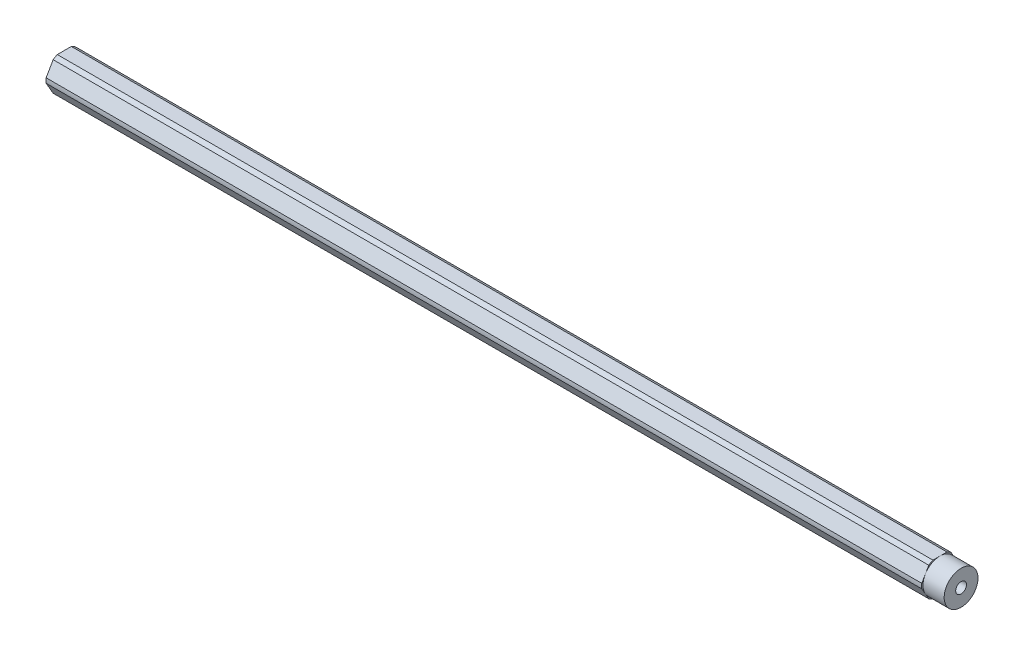
from build123d import *

# Parameters (mm, degrees)
SKETCH1_R                            = 2.0193
BOSS_EXTRUDE1_DEPTH                  = 168.275
F_10_32_TAPPED_HOLE1_D               = 4.0386
F_10_32_TAPPED_HOLE1_DEPTH           = 16.34744
F_10_32_TAPPED_HOLE1_TIP             = 1.213317848
F_10_32_TAPPED_HOLE1_ON_FACE_2_D     = 4.0386
F_10_32_TAPPED_HOLE1_ON_FACE_2_DEPTH = 16.34744
F_10_32_TAPPED_HOLE1_ON_FACE_2_TIP   = 1.213317848
SKETCH3_R                            = 8.89
SKETCH3_R_2                          = 6.35
CUT_EXTRUDE_THIN1_DEPTH              = 7.9375


with BuildPart() as part:
    # Sketch1 → Boss-Extrude1 (new, symmetric)
    with BuildSketch(Plane(origin=(0, 0, 0), x_dir=(0, 0, -1), z_dir=(1, 0, 0))):
        with BuildLine():
            ThreePointArc((4.181770846, 5.456960429), (3.437499983, 5.953924622), (2.634980936, 6.35))
            Line((2.634980936, 6.35), (-2.634980936, 6.35))
            ThreePointArc((-2.634980936, 6.35), (-3.437499983, 5.953924622), (-4.181770846, 5.456960429))
            Line((-4.181770846, 5.456960429), (-6.816751782, 0.893039571))
            ThreePointArc((-6.816751782, 0.893039571), (-6.874999966, 0), (-6.816751782, -0.893039571))
            Line((-6.816751782, -0.893039571), (-4.181770846, -5.456960429))
            ThreePointArc((-4.181770846, -5.456960429), (-3.437499983, -5.953924622), (-2.634980936, -6.35))
            Line((-2.634980936, -6.35), (2.634980936, -6.35))
            ThreePointArc((2.634980936, -6.35), (3.437499983, -5.953924622), (4.181770846, -5.456960429))
            Line((4.181770846, -5.456960429), (6.816751782, -0.893039571))
            ThreePointArc((6.816751782, -0.893039571), (6.860422465, -0.447468582), (6.874999966, 0))
            ThreePointArc((6.874999966, 0), (6.860422465, 0.447468582), (6.816751782, 0.893039571))
            Line((6.816751782, 0.893039571), (4.181770846, 5.456960429))
        make_face()
        Circle(SKETCH1_R, mode=Mode.SUBTRACT)
    extrude(amount=BOSS_EXTRUDE1_DEPTH, both=True)

    # #10-32 Tapped Hole1
    with Locations(Plane(origin=(168.275, 0, 0), x_dir=(0, 0, 1), z_dir=(1, 0, 0))):
        with Locations((0, 0)):
            Hole(F_10_32_TAPPED_HOLE1_D / 2, depth=F_10_32_TAPPED_HOLE1_DEPTH)
            with Locations((0, 0, -(F_10_32_TAPPED_HOLE1_DEPTH + F_10_32_TAPPED_HOLE1_TIP / 2))):  # 118° drill point
                Cone(0, F_10_32_TAPPED_HOLE1_D / 2, F_10_32_TAPPED_HOLE1_TIP, mode=Mode.SUBTRACT)

    # #10-32 Tapped Hole1 on face 2
    with Locations(Plane(origin=(-168.275, 0, 0), x_dir=(0, 0, 1), z_dir=(1, 0, 0))):
        with Locations((0, 0)):
            Hole(F_10_32_TAPPED_HOLE1_ON_FACE_2_D / 2, depth=F_10_32_TAPPED_HOLE1_ON_FACE_2_DEPTH)
            with Locations((0, 0, -(F_10_32_TAPPED_HOLE1_ON_FACE_2_DEPTH + F_10_32_TAPPED_HOLE1_ON_FACE_2_TIP / 2))):  # 118° drill point
                Cone(0, F_10_32_TAPPED_HOLE1_ON_FACE_2_D / 2, F_10_32_TAPPED_HOLE1_ON_FACE_2_TIP, mode=Mode.SUBTRACT)

    # Sketch3 → Cut-Extrude-Thin1 (cut)
    with BuildSketch(Plane(origin=(168.275, 0, 0), x_dir=(0, 0, -1), z_dir=(1, 0, 0))):
        Circle(SKETCH3_R)
        Circle(SKETCH3_R_2, mode=Mode.SUBTRACT)
    extrude(amount=-CUT_EXTRUDE_THIN1_DEPTH, mode=Mode.SUBTRACT)


solid = part.part
